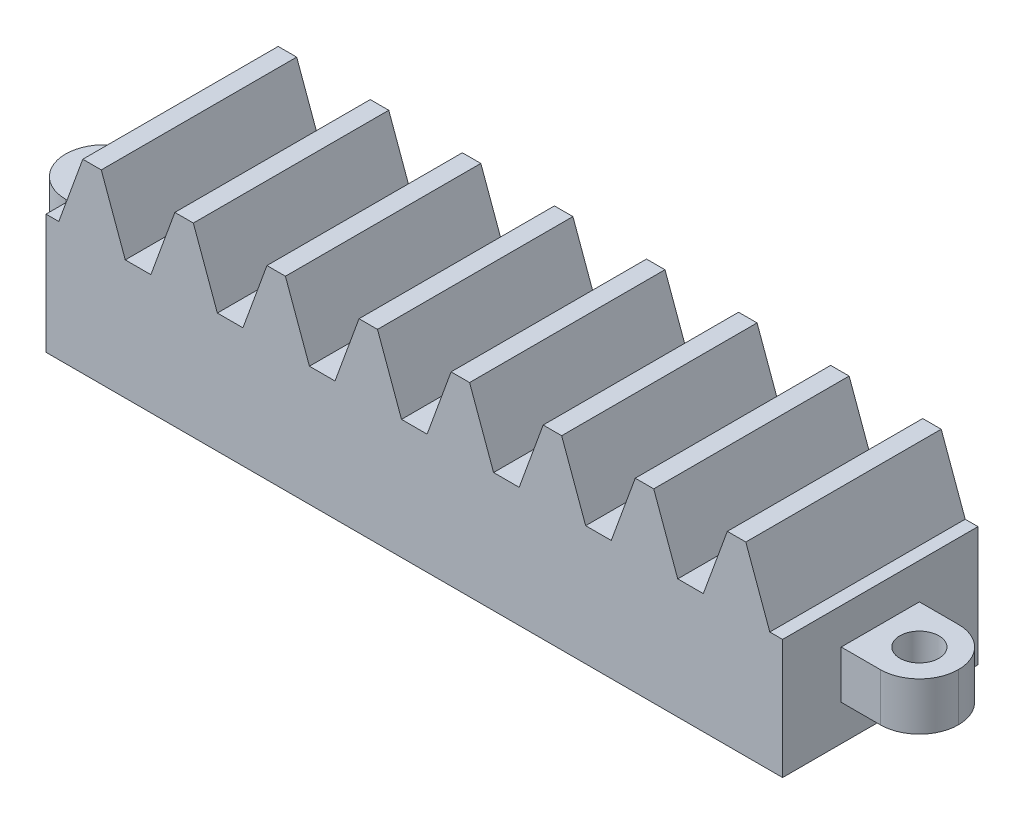
from build123d import *

# Parameters (mm, degrees)
EXTRUIR1_DEPTH = 10
CROQUIS5_W     = 4
CROQUIS5_H     = 2.45
EXTRUIR2_DEPTH = 4
REDONDEO1_R    = 2
CROQUIS6_R     = 1
EXTRUIR3_DEPTH = 4


with BuildPart() as part:
    # Croquis4 → Extruir1 (new body)
    with BuildSketch(Plane.XY):
        Polygon((32.33206977, 6.125), (31.10367023, 9.5), (30.157386445, 9.5), (28.928986905, 6.125), (27.619680795, 6.125), (26.391281255, 9.5), (25.44499747, 9.5), (24.21659793, 6.125), (22.90729182, 6.125), (21.67889228, 9.5), (20.732608495, 9.5), (19.504208955, 6.125), (18.194902845, 6.125), (16.966503305, 9.5), (16.02021952, 9.5), (14.79181998, 6.125), (13.48251387, 6.125), (12.25411433, 9.5), (11.307830545, 9.5), (10.079431005, 6.125), (8.770124895, 6.125), (7.541725355, 9.5), (6.59544157, 9.5), (5.36704203, 6.125), (4.05773592, 6.125), (2.82933638, 9.5), (1.883052595, 9.5), (0.654653055, 6.125), (0, 6.125), (0, 0), (37.6991118, 0), (37.6991118, 6.125), (37.044458745, 6.125), (35.816059205, 9.5), (34.86977542, 9.5), (33.64137588, 6.125), align=None)
    extrude(amount=EXTRUIR1_DEPTH)

    # Croquis5 → Extruir2 (add)
    with BuildSketch(Plane(origin=(37.6991118, 0, 0), x_dir=(0, 0, -1), z_dir=(1, 0, 0))):
        with Locations((-5, 3.0625)):
            Rectangle(CROQUIS5_W, CROQUIS5_H)
    extruir2 = extrude(amount=EXTRUIR2_DEPTH)

    # Simetría1: Extruir2 across plane
    add(extruir2.mirror(Plane(origin=(18.8495559, 0, 0), x_dir=(0, 0, 1), z_dir=(1, 0, 0))))

    # Redondeo1
    redondeo1_edges = [part.edges().sort_by_distance(p)[0] for p in [
        (41.6991118, 3.0625, 7),
        (41.6991118, 3.0625, 3),
        (-4, 3.0625, 3),
        (-4, 3.0625, 7),
    ]]
    fillet(redondeo1_edges, radius=REDONDEO1_R - 0.0001)  # a hair under: the kernel refuses the full size

    # Croquis6 → Extruir3 (cut)
    with BuildSketch(Plane(origin=(0, 4.2875, 0), x_dir=(1, 0, 0), z_dir=(0, 1, 0))):
        with Locations(Location((39.6991118, -5, 0), (0, 0, 270))):
            Circle(CROQUIS6_R)
        with Locations(Location((-2, -5, 0), (0, 0, 270))):
            Circle(CROQUIS6_R)
    extrude(amount=-EXTRUIR3_DEPTH, mode=Mode.SUBTRACT)


solid = part.part
